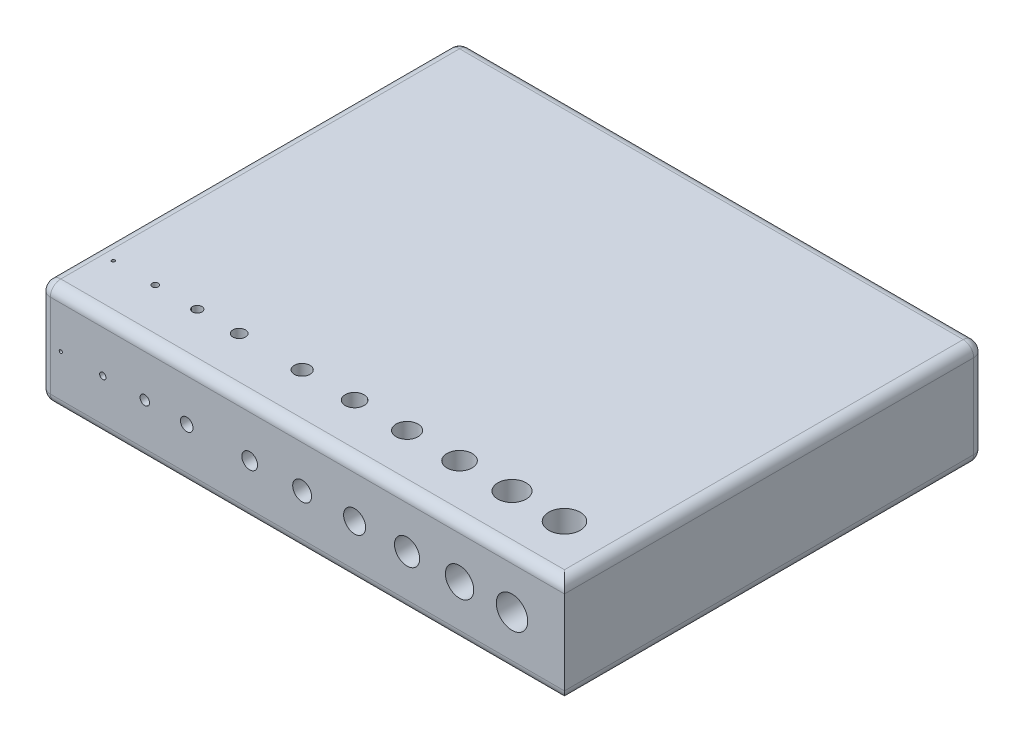
from build123d import *

# Parameters (mm, degrees)
SKETCH1_W                 = 50
SKETCH1_H                 = 40
BOSS_EXTRUDE1_DEPTH       = 10
CUT_EXTRUDE1_START        = -40
CUT_EXTRUDE1_OUTLINE_R    = 0.3
CUT_EXTRUDE1_OUTLINE_R_2  = 0.45
CUT_EXTRUDE1_OUTLINE_R_3  = 0.6
CUT_EXTRUDE1_OUTLINE_R_4  = 0.75
CUT_EXTRUDE1_OUTLINE_R_5  = 0.9
CUT_EXTRUDE1_OUTLINE_R_6  = 1.05
CUT_EXTRUDE1_OUTLINE_R_7  = 1.35
CUT_EXTRUDE1_OUTLINE_R_8  = 1.5
CUT_EXTRUDE1_OUTLINE_R_9  = 1.2
CUT_EXTRUDE1_OUTLINE_R_10 = 0.15
CUT_EXTRUDE1_DEPTH        = 40
FILLET1_R                 = 1


# Read off the part's stored shape, not the designer's step: Cut-Extrude1
with BuildPart() as part:
    # Sketch1 → Boss-Extrude1 (new body)
    with BuildSketch(Plane(origin=(0, 0, 0), x_dir=(1, 0, 0), z_dir=(0, 1, 0))):
        with Locations((0, 20)):
            Rectangle(SKETCH1_W, SKETCH1_H)
    extrude(amount=BOSS_EXTRUDE1_DEPTH)

    # Cut-Extrude1 outline → Cut-Extrude1 (cut)
    with BuildSketch(Plane.XY.offset(CUT_EXTRUDE1_START)):
        with Locations((-19, 5)):
            Circle(CUT_EXTRUDE1_OUTLINE_R)
        with Locations((-15, 5)):
            Circle(CUT_EXTRUDE1_OUTLINE_R_2)
        with Locations((-11, 5)):
            Circle(CUT_EXTRUDE1_OUTLINE_R_3)
        with Locations((-5, 5)):
            Circle(CUT_EXTRUDE1_OUTLINE_R_4)
        with Locations((0, 5)):
            Circle(CUT_EXTRUDE1_OUTLINE_R_5)
        with Locations((5, 5)):
            Circle(CUT_EXTRUDE1_OUTLINE_R_6)
        with Locations((15, 5)):
            Circle(CUT_EXTRUDE1_OUTLINE_R_7)
        with Locations((20, 5)):
            Circle(CUT_EXTRUDE1_OUTLINE_R_8)
        with Locations((10, 5)):
            Circle(CUT_EXTRUDE1_OUTLINE_R_9)
        with Locations((-23, 5)):
            Circle(CUT_EXTRUDE1_OUTLINE_R_10)
    cut_extrude1 = extrude(amount=CUT_EXTRUDE1_DEPTH, mode=Mode.SUBTRACT)

    # Mirror1: Cut-Extrude1 across plane
    add(cut_extrude1.mirror(Plane(origin=(0, 0, 0), x_dir=(0, -0.7071067811865478, 0.7071067811865472), z_dir=(0, 0.7071067811865475, 0.7071067811865477))), mode=Mode.SUBTRACT)

    # Fillet1
    # the kernel refuses this fillet: 1 mm, written as the material it takes off along each edge
    with BuildSketch(Plane(origin=(24, 9, -39), x_dir=(0, 1, 0), z_dir=(0, 0, -1))) as fillet1_piece_1_section:
        Polygon((0, 0), (FILLET1_R, 0), (FILLET1_R, FILLET1_R), (0, FILLET1_R), align=None)
    fillet1_piece_1 = extrude(amount=FILLET1_R, mode=Mode.PRIVATE)
    fillet1_piece_1 = fillet1_piece_1 - Plane(origin=(24, 9, -39), x_dir=(-0.7071067811865475, -0.7071067811865475, 0), z_dir=(0, 0, -1)) * Sphere(FILLET1_R, mode=Mode.PRIVATE)
    add(fillet1_piece_1, mode=Mode.SUBTRACT)
    with BuildSketch(Plane(origin=(-24, 9, -39), x_dir=(-1, 0, 0), z_dir=(0, 0, -1))) as fillet1_piece_2_section:
        Polygon((0, 0), (FILLET1_R, 0), (FILLET1_R, FILLET1_R), (0, FILLET1_R), align=None)
    fillet1_piece_2 = extrude(amount=FILLET1_R, mode=Mode.PRIVATE)
    fillet1_piece_2 = fillet1_piece_2 - Plane(origin=(-24, 9, -39), x_dir=(0.7071067811865475, -0.7071067811865475, 0), z_dir=(0, 0, -1)) * Sphere(FILLET1_R, mode=Mode.PRIVATE)
    add(fillet1_piece_2, mode=Mode.SUBTRACT)
    with BuildSketch(Plane(origin=(-24, 9, -1), x_dir=(0, 1, 0), z_dir=(-1, 0, 0))) as fillet1_piece_3_section:
        Polygon((0, 0), (FILLET1_R, 0), (FILLET1_R, -FILLET1_R), (0, -FILLET1_R), align=None)
    fillet1_piece_3 = extrude(amount=FILLET1_R, mode=Mode.PRIVATE)
    fillet1_piece_3 = fillet1_piece_3 - Plane(origin=(-24, 9, -1), x_dir=(0, -0.7071067811865475, -0.7071067811865475), z_dir=(-1, 0, 0)) * Sphere(FILLET1_R, mode=Mode.PRIVATE)
    add(fillet1_piece_3, mode=Mode.SUBTRACT)
    with BuildSketch(Plane(origin=(-24, 1, -39), x_dir=(-1, 0, 0), z_dir=(0, 0, -1))) as fillet1_piece_4_section:
        Polygon((0, 0), (FILLET1_R, 0), (FILLET1_R, -FILLET1_R), (0, -FILLET1_R), align=None)
    fillet1_piece_4 = extrude(amount=FILLET1_R, mode=Mode.PRIVATE)
    fillet1_piece_4 = fillet1_piece_4 - Plane(origin=(-24, 1, -39), x_dir=(0.7071067811865475, 0.7071067811865475, 0), z_dir=(0, 0, -1)) * Sphere(FILLET1_R, mode=Mode.PRIVATE)
    add(fillet1_piece_4, mode=Mode.SUBTRACT)
    with BuildSketch(Plane(origin=(24, 1, -39), x_dir=(0, -1, 0), z_dir=(0, 0, -1))) as fillet1_piece_5_section:
        Polygon((0, 0), (FILLET1_R, 0), (FILLET1_R, -FILLET1_R), (0, -FILLET1_R), align=None)
    fillet1_piece_5 = extrude(amount=FILLET1_R, mode=Mode.PRIVATE)
    fillet1_piece_5 = fillet1_piece_5 - Plane(origin=(24, 1, -39), x_dir=(-0.7071067811865475, 0.7071067811865475, 0), z_dir=(0, 0, -1)) * Sphere(FILLET1_R, mode=Mode.PRIVATE)
    add(fillet1_piece_5, mode=Mode.SUBTRACT)
    with BuildSketch(Plane(origin=(-24, 1, -1), x_dir=(0, -1, 0), z_dir=(-1, 0, 0))) as fillet1_piece_6_section:
        Polygon((0, 0), (FILLET1_R, 0), (FILLET1_R, FILLET1_R), (0, FILLET1_R), align=None)
    fillet1_piece_6 = extrude(amount=FILLET1_R, mode=Mode.PRIVATE)
    fillet1_piece_6 = fillet1_piece_6 - Plane(origin=(-24, 1, -1), x_dir=(0, 0.7071067811865475, -0.7071067811865475), z_dir=(-1, 0, 0)) * Sphere(FILLET1_R, mode=Mode.PRIVATE)
    add(fillet1_piece_6, mode=Mode.SUBTRACT)
    with BuildSketch(Plane(origin=(25, 10, -39), x_dir=(-1, 0, 0), z_dir=(0, 0, 1))) as fillet1_piece_7:
        with BuildLine():
            CenterArc((FILLET1_R, FILLET1_R), FILLET1_R, 180, 90)
            Line((0, FILLET1_R), (0, 0))
            Line((0, 0), (FILLET1_R, 0))
        make_face()
    extrude(amount=41.5, mode=Mode.SUBTRACT)
    with BuildSketch(Plane(origin=(-24, 10, -40), x_dir=(0, -1, 0), z_dir=(1, 0, 0))) as fillet1_piece_8:
        with BuildLine():
            CenterArc((FILLET1_R, -FILLET1_R), FILLET1_R, 90, 90)
            Line((0, -FILLET1_R), (0, 0))
            Line((0, 0), (FILLET1_R, 0))
        make_face()
    extrude(amount=48, mode=Mode.SUBTRACT)
    with BuildSketch(Plane(origin=(-23, 5, -40), x_dir=(1, 0, 0), z_dir=(0, -1, 0))) as fillet1_piece_9:
        with BuildLine():
            CenterArc((0.15 + FILLET1_R, FILLET1_R), FILLET1_R, 180, 90)
            Line((0.15, FILLET1_R), (0.15, 0))
            Line((0.15, 0), (0.15 + FILLET1_R, 0))
        make_face()
    revolve(axis=Axis((-23, 5, -40), (0, 0, 1)), mode=Mode.SUBTRACT)
    with BuildSketch(Plane(origin=(10, 5, -40), x_dir=(1, 0, 0), z_dir=(0, -1, 0))) as fillet1_piece_10:
        with BuildLine():
            CenterArc((1.2 + FILLET1_R, FILLET1_R), FILLET1_R, 180, 90)
            Line((1.2, FILLET1_R), (1.2, 0))
            Line((1.2, 0), (1.2 + FILLET1_R, 0))
        make_face()
    revolve(axis=Axis((10, 5, -40), (0, 0, 1)), mode=Mode.SUBTRACT)
    with BuildSketch(Plane(origin=(20, 5, -40), x_dir=(1, 0, 0), z_dir=(0, -1, 0))) as fillet1_piece_11:
        with BuildLine():
            CenterArc((1.5 + FILLET1_R, FILLET1_R), FILLET1_R, 180, 90)
            Line((1.5, FILLET1_R), (1.5, 0))
            Line((1.5, 0), (1.5 + FILLET1_R, 0))
        make_face()
    revolve(axis=Axis((20, 5, -40), (0, 0, 1)), mode=Mode.SUBTRACT)
    with BuildSketch(Plane(origin=(15, 5, -40), x_dir=(1, 0, 0), z_dir=(0, -1, 0))) as fillet1_piece_12:
        with BuildLine():
            CenterArc((1.35 + FILLET1_R, FILLET1_R), FILLET1_R, 180, 90)
            Line((1.35, FILLET1_R), (1.35, 0))
            Line((1.35, 0), (1.35 + FILLET1_R, 0))
        make_face()
    revolve(axis=Axis((15, 5, -40), (0, 0, 1)), mode=Mode.SUBTRACT)
    with BuildSketch(Plane(origin=(5, 5, -40), x_dir=(1, 0, 0), z_dir=(0, -1, 0))) as fillet1_piece_13:
        with BuildLine():
            CenterArc((1.05 + FILLET1_R, FILLET1_R), FILLET1_R, 180, 90)
            Line((1.05, FILLET1_R), (1.05, 0))
            Line((1.05, 0), (1.05 + FILLET1_R, 0))
        make_face()
    revolve(axis=Axis((5, 5, -40), (0, 0, 1)), mode=Mode.SUBTRACT)
    with BuildSketch(Plane(origin=(0, 5, -40), x_dir=(1, 0, 0), z_dir=(0, -1, 0))) as fillet1_piece_14:
        with BuildLine():
            CenterArc((0.9 + FILLET1_R, FILLET1_R), FILLET1_R, 180, 90)
            Line((0.9, FILLET1_R), (0.9, 0))
            Line((0.9, 0), (0.9 + FILLET1_R, 0))
        make_face()
    revolve(axis=Axis((0, 5, -40), (0, 0, 1)), mode=Mode.SUBTRACT)
    with BuildSketch(Plane(origin=(-5, 5, -40), x_dir=(1, 0, 0), z_dir=(0, -1, 0))) as fillet1_piece_15:
        with BuildLine():
            CenterArc((0.75 + FILLET1_R, FILLET1_R), FILLET1_R, 180, 90)
            Line((0.75, FILLET1_R), (0.75, 0))
            Line((0.75, 0), (0.75 + FILLET1_R, 0))
        make_face()
    revolve(axis=Axis((-5, 5, -40), (0, 0, 1)), mode=Mode.SUBTRACT)
    with BuildSketch(Plane(origin=(-11, 5, -40), x_dir=(1, 0, 0), z_dir=(0, -1, 0))) as fillet1_piece_16:
        with BuildLine():
            CenterArc((0.6 + FILLET1_R, FILLET1_R), FILLET1_R, 180, 90)
            Line((0.6, FILLET1_R), (0.6, 0))
            Line((0.6, 0), (0.6 + FILLET1_R, 0))
        make_face()
    revolve(axis=Axis((-11, 5, -40), (0, 0, 1)), mode=Mode.SUBTRACT)
    with BuildSketch(Plane(origin=(-15, 5, -40), x_dir=(1, 0, 0), z_dir=(0, -1, 0))) as fillet1_piece_17:
        with BuildLine():
            CenterArc((0.45 + FILLET1_R, FILLET1_R), FILLET1_R, 180, 90)
            Line((0.45, FILLET1_R), (0.45, 0))
            Line((0.45, 0), (0.45 + FILLET1_R, 0))
        make_face()
    revolve(axis=Axis((-15, 5, -40), (0, 0, 1)), mode=Mode.SUBTRACT)
    with BuildSketch(Plane(origin=(-19, 5, -40), x_dir=(1, 0, 0), z_dir=(0, -1, 0))) as fillet1_piece_18:
        with BuildLine():
            CenterArc((0.3 + FILLET1_R, FILLET1_R), FILLET1_R, 180, 90)
            Line((0.3, FILLET1_R), (0.3, 0))
            Line((0.3, 0), (0.3 + FILLET1_R, 0))
        make_face()
    revolve(axis=Axis((-19, 5, -40), (0, 0, 1)), mode=Mode.SUBTRACT)
    with BuildSketch(Plane(origin=(-25, 10, -1), x_dir=(0, -1, 0), z_dir=(0, 0, -1))) as fillet1_piece_19:
        with BuildLine():
            CenterArc((FILLET1_R, -FILLET1_R), FILLET1_R, 90, 90)
            Line((0, -FILLET1_R), (0, 0))
            Line((0, 0), (FILLET1_R, 0))
        make_face()
    extrude(amount=38, mode=Mode.SUBTRACT)
    with BuildSketch(Plane(origin=(-24, 0, -40), x_dir=(0, 1, 0), z_dir=(1, 0, 0))) as fillet1_piece_20:
        with BuildLine():
            CenterArc((FILLET1_R, FILLET1_R), FILLET1_R, 180, 90)
            Line((0, FILLET1_R), (0, 0))
            Line((0, 0), (FILLET1_R, 0))
        make_face()
    extrude(amount=48, mode=Mode.SUBTRACT)
    with BuildSketch(Plane(origin=(25, 0, -39), x_dir=(-1, 0, 0), z_dir=(0, 0, 1))) as fillet1_piece_21:
        with BuildLine():
            CenterArc((FILLET1_R, -FILLET1_R), FILLET1_R, 90, 90)
            Line((0, -FILLET1_R), (0, 0))
            Line((0, 0), (FILLET1_R, 0))
        make_face()
    extrude(amount=41.5, mode=Mode.SUBTRACT)
    with BuildSketch(Plane(origin=(27.5, 0, 0), x_dir=(0, 0, -1), z_dir=(-1, 0, 0))) as fillet1_piece_22:
        with BuildLine():
            CenterArc((FILLET1_R, -FILLET1_R), FILLET1_R, 90, 90)
            Line((0, -FILLET1_R), (0, 0))
            Line((0, 0), (FILLET1_R, 0))
        make_face()
    extrude(amount=51.5, mode=Mode.SUBTRACT)
    with BuildSketch(Plane(origin=(-25, 0, -1), x_dir=(0, 1, 0), z_dir=(0, 0, -1))) as fillet1_piece_23:
        with BuildLine():
            CenterArc((FILLET1_R, FILLET1_R), FILLET1_R, 180, 90)
            Line((0, FILLET1_R), (0, 0))
            Line((0, 0), (FILLET1_R, 0))
        make_face()
    extrude(amount=38, mode=Mode.SUBTRACT)
    with BuildSketch(Plane(origin=(-25, 1, -40), x_dir=(1, 0, 0), z_dir=(0, 1, 0)), Plane(origin=(-25, 1, 0), x_dir=(0, 0, -1), z_dir=(0, 1, 0))) as fillet1_piece_24:
        with BuildLine():
            CenterArc((FILLET1_R, -FILLET1_R), FILLET1_R, 90, 90)
            Line((0, -FILLET1_R), (0, 0))
            Line((0, 0), (FILLET1_R, 0))
        make_face()
    extrude(amount=8, mode=Mode.SUBTRACT)
    with BuildSketch(Plane(origin=(25, 1, -40), x_dir=(-1, 0, 0), z_dir=(0, 1, 0))) as fillet1_piece_25:
        with BuildLine():
            CenterArc((FILLET1_R, FILLET1_R), FILLET1_R, 180, 90)
            Line((0, FILLET1_R), (0, 0))
            Line((0, 0), (FILLET1_R, 0))
        make_face()
    extrude(amount=8, mode=Mode.SUBTRACT)
    with BuildSketch(Plane(origin=(27.5, 10, 0), x_dir=(0, 0, -1), z_dir=(-1, 0, 0))) as fillet1_piece_26:
        with BuildLine():
            CenterArc((FILLET1_R, FILLET1_R), FILLET1_R, 180, 90)
            Line((0, FILLET1_R), (0, 0))
            Line((0, 0), (FILLET1_R, 0))
        make_face()
    extrude(amount=51.5, mode=Mode.SUBTRACT)


solid = part.part
